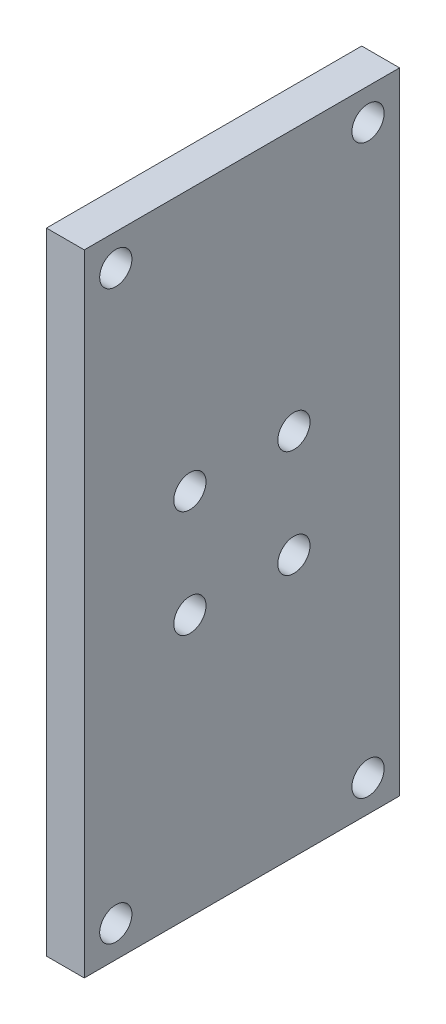
from build123d import *

# Parameters (mm, degrees)
SKETCH1_W           = 100
SKETCH1_H           = 50
SKETCH1_R           = 2.555
BOSS_EXTRUDE1_DEPTH = 6


with BuildPart() as part:
    # Sketch1 → Boss-Extrude1 (new body)
    with BuildSketch(Plane.YZ):
        Rectangle(SKETCH1_W, SKETCH1_H)
        with Locations((-8.5, 8.25)):
            Circle(SKETCH1_R, mode=Mode.SUBTRACT)
        with Locations((-8.5, -8.25)):
            Circle(SKETCH1_R, mode=Mode.SUBTRACT)
        with Locations((8.5, -8.25)):
            Circle(SKETCH1_R, mode=Mode.SUBTRACT)
        with Locations((8.5, 8.25)):
            Circle(SKETCH1_R, mode=Mode.SUBTRACT)
        with Locations((-45, 20)):
            Circle(SKETCH1_R, mode=Mode.SUBTRACT)
        with Locations((-45, -20)):
            Circle(SKETCH1_R, mode=Mode.SUBTRACT)
        with Locations((45, 20)):
            Circle(SKETCH1_R, mode=Mode.SUBTRACT)
        with Locations((45, -20)):
            Circle(SKETCH1_R, mode=Mode.SUBTRACT)
    extrude(amount=BOSS_EXTRUDE1_DEPTH)


solid = part.part
